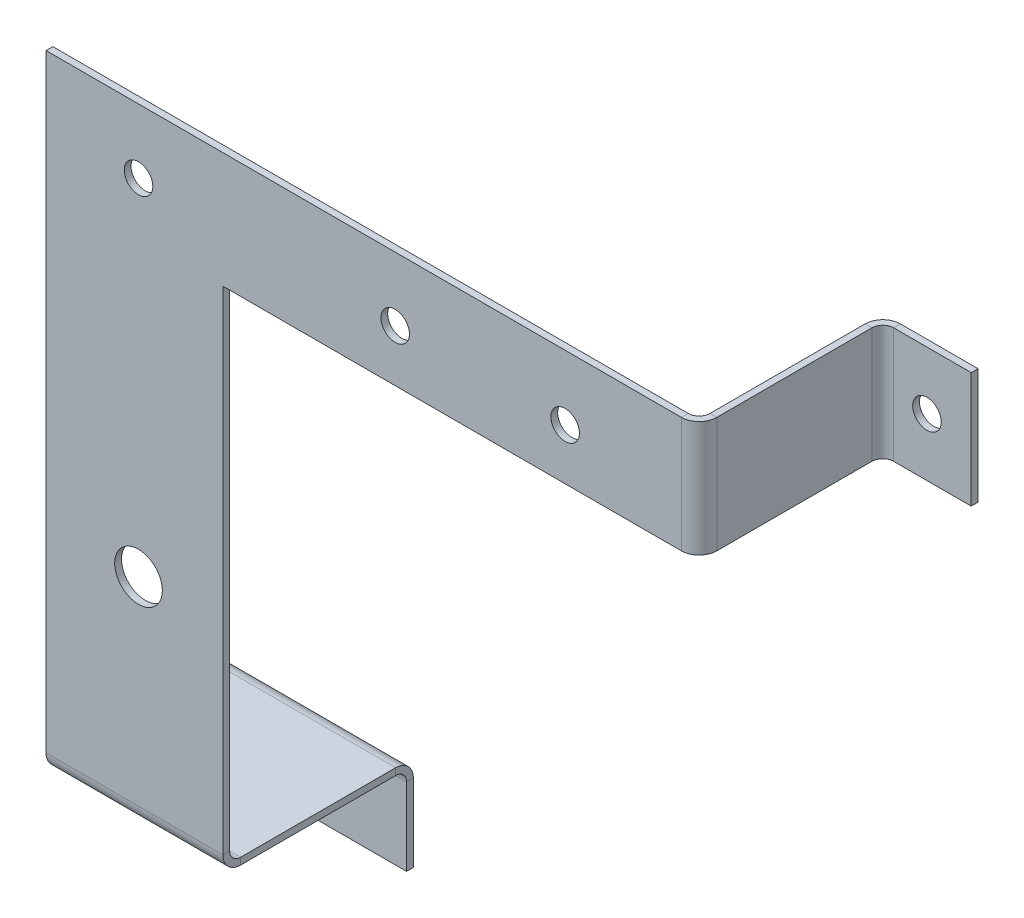
from build123d import *

# Parameters (mm, degrees)
BASE_FLANGE1_DEPTH           = 1
EDGE_FLANGE1_STRIP_W         = 7.2
EDGE_FLANGE1_STRIP_H         = 1
EDGE_FLANGE1_STRIP_CUT_DEPTH = 17
EDGE_FLANGE1_DEPTH           = 17
EDGE_FLANGE2_STRIP_W         = 7.2
EDGE_FLANGE2_STRIP_H         = 1
EDGE_FLANGE2_STRIP_CUT_DEPTH = 17
EDGE_FLANGE2_DEPTH           = 17
EDGE_FLANGE3_STRIP_W         = 7.2
EDGE_FLANGE3_STRIP_H         = 1
EDGE_FLANGE3_STRIP_CUT_DEPTH = 26
EDGE_FLANGE3_DEPTH           = 26
EDGE_FLANGE4_STRIP_W         = 7.2
EDGE_FLANGE4_STRIP_H         = 1
EDGE_FLANGE4_STRIP_CUT_DEPTH = 26
EDGE_FLANGE4_DEPTH           = 26
SKETCH18_R                   = 2.1
CUT_EXTRUDE1_DEPTH           = 6
SKETCH19_R                   = 2.1
CUT_EXTRUDE2_DEPTH           = 40
SKETCH20_R                   = 3.5
CUT_EXTRUDE3_DEPTH           = 40


# Sheet-metal steps are written as plain solids
with BuildPart() as part:
    # Sketch1 → Base-Flange1 (new body)
    with BuildSketch(Plane.XY):
        Polygon((0, 0), (0, 17), (-96, 17), (-96, -75), (-70, -75), (-70, 0), align=None)
    extrude(amount=-BASE_FLANGE1_DEPTH)

    # Edge-Flange1 strip (across the edge) → Edge-Flange1 strip cut (cut)
    with BuildSketch(Plane(origin=(0, 17, -1), x_dir=(-1, 0, 0), z_dir=(0, -1, 0))):
        with Locations((-1, -0.5)):
            Rectangle(EDGE_FLANGE1_STRIP_W, EDGE_FLANGE1_STRIP_H)
    extrude(amount=EDGE_FLANGE1_STRIP_CUT_DEPTH, mode=Mode.SUBTRACT)

    # Edge-Flange1 section (across the edge) → Edge-Flange1 (add)
    with BuildSketch(Plane(origin=(0, 17, -1), x_dir=(-1, 0, 0), z_dir=(0, -1, 0))):
        with BuildLine():
            Line((0, 1.6), (0, 27))
            Line((0, 27), (1, 27))
            Line((1, 27), (1, 1.6))
            ThreePointArc((1, 1.6), (1.46862915, 0.46862915), (2.6, 0))
            Line((2.6, 0), (2.6, -1))
            ThreePointArc((2.6, -1), (0.761522369, -0.238477631), (0, 1.6))
        make_face()
    extrude(amount=EDGE_FLANGE1_DEPTH)

    # Edge-Flange2 strip (across the edge) → Edge-Flange2 strip cut (cut)
    with BuildSketch(Plane(origin=(0, 0, -28), x_dir=(0, 0, 1), z_dir=(0, 1, 0))):
        with Locations((-1, -0.5)):
            Rectangle(EDGE_FLANGE2_STRIP_W, EDGE_FLANGE2_STRIP_H)
    extrude(amount=EDGE_FLANGE2_STRIP_CUT_DEPTH, mode=Mode.SUBTRACT)

    # Edge-Flange2 section (across the edge) → Edge-Flange2 (add)
    with BuildSketch(Plane(origin=(0, 0, -28), x_dir=(0, 0, 1), z_dir=(0, 1, 0))):
        with BuildLine():
            Line((0, 1.6), (0, 13))
            Line((0, 13), (1, 13))
            Line((1, 13), (1, 1.6))
            ThreePointArc((1, 1.6), (1.46862915, 0.46862915), (2.6, 0))
            Line((2.6, 0), (2.6, -1))
            ThreePointArc((2.6, -1), (0.761522369, -0.238477631), (0, 1.6))
        make_face()
    extrude(amount=EDGE_FLANGE2_DEPTH)

    # Edge-Flange3 strip (across the edge) → Edge-Flange3 strip cut (cut)
    with BuildSketch(Plane(origin=(-70, -75, -1), x_dir=(0, 1, 0), z_dir=(-1, 0, 0))):
        with Locations((-1, -0.5)):
            Rectangle(EDGE_FLANGE3_STRIP_W, EDGE_FLANGE3_STRIP_H)
    extrude(amount=EDGE_FLANGE3_STRIP_CUT_DEPTH, mode=Mode.SUBTRACT)

    # Edge-Flange3 section (across the edge) → Edge-Flange3 (add)
    with BuildSketch(Plane(origin=(-70, -75, -1), x_dir=(0, 1, 0), z_dir=(-1, 0, 0))):
        with BuildLine():
            Line((0, 1.6), (0, 27))
            Line((0, 27), (1, 27))
            Line((1, 27), (1, 1.6))
            ThreePointArc((1, 1.6), (1.46862915, 0.46862915), (2.6, 0))
            Line((2.6, 0), (2.6, -1))
            ThreePointArc((2.6, -1), (0.761522369, -0.238477631), (0, 1.6))
        make_face()
    extrude(amount=EDGE_FLANGE3_DEPTH)

    # Edge-Flange4 strip (across the edge) → Edge-Flange4 strip cut (cut)
    with BuildSketch(Plane(origin=(-96, -75, -28), x_dir=(0, 0, 1), z_dir=(1, 0, 0))):
        with Locations((-1, -0.5)):
            Rectangle(EDGE_FLANGE4_STRIP_W, EDGE_FLANGE4_STRIP_H)
    extrude(amount=EDGE_FLANGE4_STRIP_CUT_DEPTH, mode=Mode.SUBTRACT)

    # Edge-Flange4 section (across the edge) → Edge-Flange4 (add)
    with BuildSketch(Plane(origin=(-96, -75, -28), x_dir=(0, 0, 1), z_dir=(1, 0, 0))):
        with BuildLine():
            Line((0, 1.6), (0, 13))
            Line((0, 13), (1, 13))
            Line((1, 13), (1, 1.6))
            ThreePointArc((1, 1.6), (1.46862915, 0.46862915), (2.6, 0))
            Line((2.6, 0), (2.6, -1))
            ThreePointArc((2.6, -1), (0.761522369, -0.238477631), (0, 1.6))
        make_face()
    extrude(amount=EDGE_FLANGE4_DEPTH)

    # Sketch18 → Cut-Extrude1 (cut)
    with BuildSketch(Plane.XY.offset(-27)):
        with Locations((6.5, 8.5)):
            Circle(SKETCH18_R)
    extrude(amount=-CUT_EXTRUDE1_DEPTH, mode=Mode.SUBTRACT)

    # Sketch19 → Cut-Extrude2 (cut)
    with BuildSketch(Plane.XY):
        with Locations((-44.672390486, 7.611585351)):
            Circle(SKETCH19_R)
        with Locations((-82.401549953, 7.538197483)):
            Circle(SKETCH19_R)
        with Locations((-83, -82.3)):
            Circle(SKETCH19_R)
        with Locations((-19.687589167, 7.489085351)):
            Circle(SKETCH19_R)
    extrude(amount=-CUT_EXTRUDE2_DEPTH, mode=Mode.SUBTRACT)

    # Sketch20 → Cut-Extrude3 (cut)
    with BuildSketch(Plane.XY):
        with Locations((-82.401549953, -43.198683771)):
            Circle(SKETCH20_R)
    extrude(amount=-CUT_EXTRUDE3_DEPTH, mode=Mode.SUBTRACT)


solid = part.part
